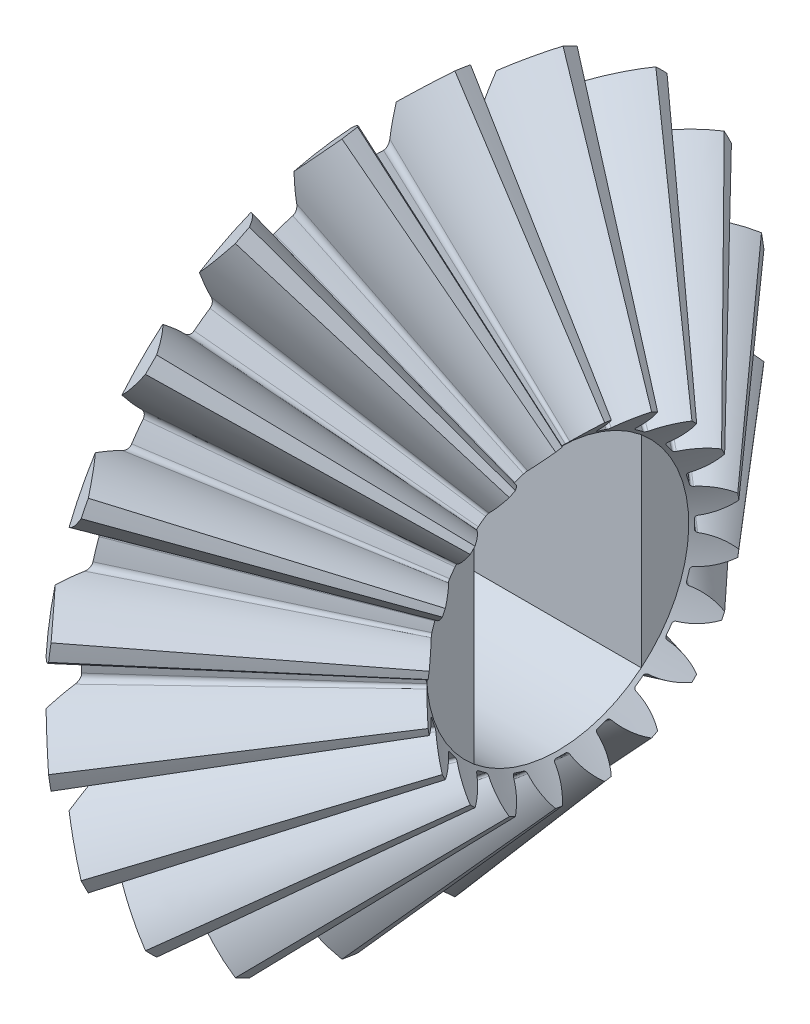
from build123d import *

# Parameters (mm, degrees)
TEETHCUTS_COUNT         = 20
TEETHCUTS_ANGLE         = 342
HUBSKE_R                = 8.949062546
HUB_DEPTH               = 0.0001016
BORSKE_R                = 0.4
BORE_DEPTH              = 11.050988254
SKETCH1_R               = 0.4
CUT_EXTRUDE1_DEPTH      = 17.254341912
CUT_EXTRUDE2_DEPTH      = 17.562962685
CUT_EXTRUDE2_DEPTH_BACK = 17.562962685
SKETCH2_W               = 10.444126269
SKETCH2_H               = 24.82236288


with BuildPart() as part:
    # BasProSke → Base-Revolve (revolve)
    with BuildSketch(Plane(origin=(0, 0, 0), x_dir=(1, 0, 0), z_dir=(0, 1, 0)), mode=Mode.PRIVATE) as base_revolve_sk:
        Polygon((0, 0), (0, 8.949062547), (1.758044236, 10.707106781), (7.01489848, 4.650252526), (6.251354245, 3.886708293), (6.251354245, 0), align=None)
    revolve(base_revolve_sk.sketch.rotate(Axis((-10, 0, 0), (1, 0, 0)), 180), axis=Axis((-10, 0, 0), (1, 0, 0)))

    # ToothCut: read off the stored shape, not the designer's step
    # ToothCut: loft between two sections, ruled curve by curve
    toothcut_from = [
        Edge.make_bspline([(11.056978059, 0.006040604, -0.009397446), (11.052757644, 0.001820189, -0.014823153), (11.047082221, -0.003855234, -0.014022361), (11.043703013, -0.007234441, -0.007524359)], [0, 0, 0, 0, 1, 1, 1, 1], 3, [1, 0.779680287, 0.779680287, 1]),
        Edge.make_bspline([(11.043703013, -0.007234441, 0.007524359), (11.047082221, -0.003855234, 0.014022361), (11.052757644, 0.001820189, 0.014823153), (11.056978059, 0.006040604, 0.009397446)], [0, 0, 0, 0, 1, 1, 1, 1], 3, [1, 0.779680287, 0.779680287, 1]),
        Edge.make_bspline([(11.043703013, -0.007234441, -0.007524359), (11.043200956, -0.007736499, -0.006558934), (11.042799872, -0.008137583, -0.005503268), (11.04250773, -0.008429724, -0.004378334)], [0, 0, 0, 0, 1, 1, 1, 1], 3, [1, 0.993377071, 0.993377071, 1]),
        Edge.make_bspline([(11.04250773, -0.008429724, 0.004378334), (11.042799872, -0.008137583, 0.005503268), (11.043200956, -0.007736499, 0.006558934), (11.043703013, -0.007234441, 0.007524359)], [0, 0, 0, 0, 1, 1, 1, 1], 3, [1, 0.993377071, 0.993377071, 1]),
        Edge.make_bspline([(11.04250773, -0.008429724, -0.004378334), (11.041765856, -0.009171599, -0.001521635), (11.041765856, -0.009171599, 0.001521635), (11.04250773, -0.008429724, 0.004378334)], [0, 0, 0, 0, 1, 1, 1, 1], 3, [1, 0.959129516, 0.959129516, 1]),
        Edge.make_line((11.056978059, 0.006040604, 0.009397446), (11.056978059, 0.006040604, -0.009397446)),
    ]
    toothcut_to = [
        Edge.make_bspline([(1.831702175, 10.780764719, -1.608058394), (1.416177176, 10.365239721, -1.022568098), (0.895186141, 9.844248687, -0.641441323), (0.317192874, 9.266255421, -0.500131372)], [0, 0, 0, 0, 1, 1, 1, 1], 3, [1, 0.968992554, 0.968992554, 1]),
        Edge.make_bspline([(0.317192874, 9.266255421, 0.500131372), (0.895186141, 9.844248687, 0.641441323), (1.416177176, 10.365239721, 1.022568098), (1.831702175, 10.780764719, 1.608058394)], [0, 0, 0, 0, 1, 1, 1, 1], 3, [1, 0.968992554, 0.968992554, 1]),
        Edge.make_bspline([(0.317192874, 9.266255421, -0.500131372), (0.248143517, 9.197206064, -0.483249928), (0.20395306, 9.153015607, -0.406340777), (0.206397022, 9.155459569, -0.307302074)], [0, 0, 0, 0, 1, 1, 1, 1], 3, [1, 0.835744927, 0.835744927, 1]),
        Edge.make_bspline([(0.206397022, 9.155459569, 0.307302074), (0.20395306, 9.153015607, 0.406340777), (0.248143517, 9.197206064, 0.483249928), (0.317192874, 9.266255421, 0.500131372)], [0, 0, 0, 0, 1, 1, 1, 1], 3, [1, 0.835744927, 0.835744927, 1]),
        Edge.make_bspline([(0.206397022, 9.155459569, -0.307302074), (0.211451493, 9.16051404, -0.102475588), (0.211451493, 9.16051404, 0.102475588), (0.206397022, 9.155459569, 0.307302074)], [0, 0, 0, 0, 1, 1, 1, 1], 3, [1, 0.999594406, 0.999594406, 1]),
        Edge.make_line((1.831702175, 10.780764719, 1.608058394), (1.831702175, 10.780764719, -1.608058394)),
    ]
    toothcut = Solid(Shell([*[Face.make_surface_from_curves(toothcut_from[k], toothcut_to[k]) for k in range(6)], Face(Wire(toothcut_from)), Face(Wire(toothcut_to))]))
    add(toothcut, mode=Mode.SUBTRACT)

    # TeethCuts: ToothCut ×20 about axis
    teethcuts_axis = Axis((-10, 0, 0), (1, 0, 0))
    for i in range(1, TEETHCUTS_COUNT):
        add(toothcut.rotate(teethcuts_axis, i * TEETHCUTS_ANGLE / (TEETHCUTS_COUNT - 1)), mode=Mode.SUBTRACT)

    # HubSke → Hub (add)
    with BuildSketch(Plane.ZY):
        Circle(HUBSKE_R)
    extrude(amount=HUB_DEPTH)

    # BorSke → Bore (cut, symmetric)
    with BuildSketch(Plane(origin=(0, 0, 0), x_dir=(0, 0, -1), z_dir=(1, 0, 0))):
        with Locations(Location((0, 0, 0), (0, 0, 180))):
            Circle(BORSKE_R)
    extrude(amount=BORE_DEPTH, both=True, mode=Mode.SUBTRACT)

    # Sketch1 → Cut-Extrude1 (cut, through all)
    with BuildSketch(Plane(origin=(6.251354245, 0, 0), x_dir=(0, 0, -1), z_dir=(1, 0, 0))):
        with BuildLine():
            ThreePointArc((2.477983051, 2.994344896), (0, 3.886708293), (-2.477983051, 2.994344896))
            Line((-2.477983051, 2.994344896), (-2.477983051, -2.994344896))
            ThreePointArc((-2.477983051, -2.994344896), (0, -3.886708293), (2.477983051, -2.994344896))
            Line((2.477983051, -2.994344896), (2.477983051, 2.994344896))
        make_face()
        Circle(SKETCH1_R, mode=Mode.SUBTRACT)
    extrude(amount=-CUT_EXTRUDE1_DEPTH, mode=Mode.SUBTRACT)

    # Sketch2 → Cut-Extrude2 (cut, two sides: drawn at the far end of the back side and taken through both)
    with BuildSketch(Plane.XY.offset(-CUT_EXTRUDE2_DEPTH_BACK)):
        with Locations((-4.43083898, -0.304425205)):
            Rectangle(SKETCH2_W, SKETCH2_H)
    extrude(amount=CUT_EXTRUDE2_DEPTH + CUT_EXTRUDE2_DEPTH_BACK, mode=Mode.SUBTRACT)


solid = part.part
